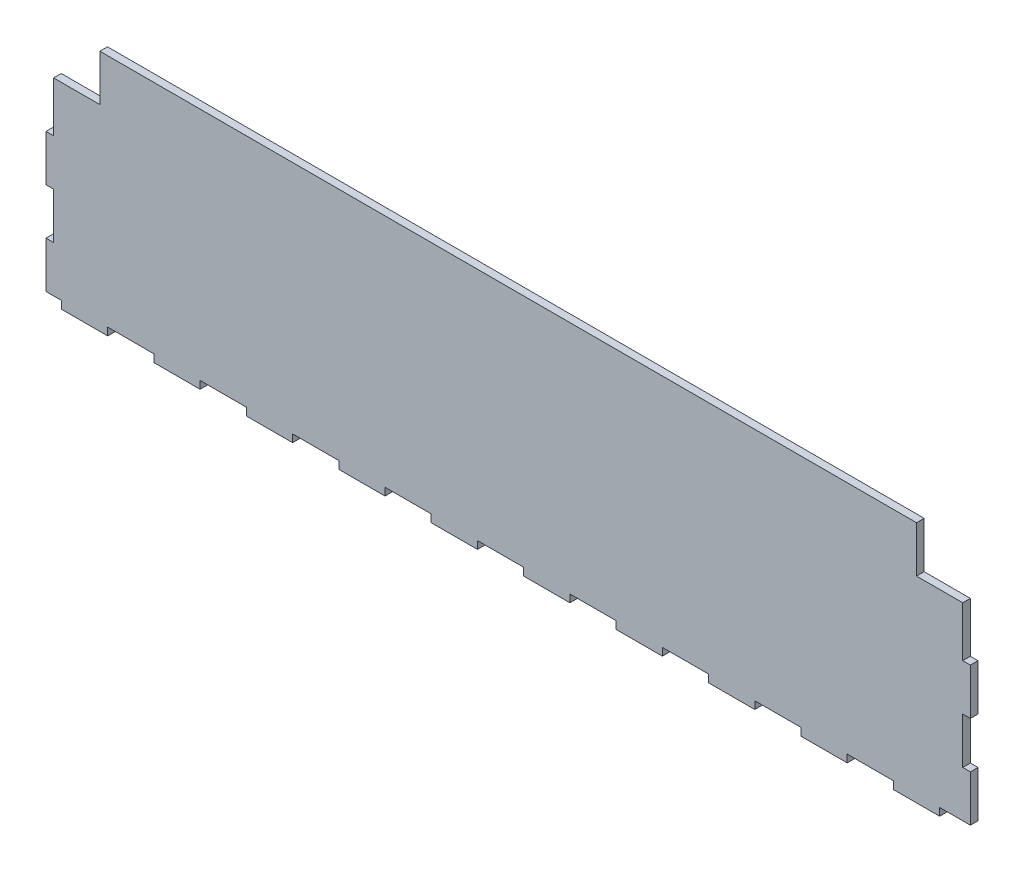
from build123d import *

# Parameters (mm, degrees)
BOSS_EXTRUDE1_DEPTH = 3.3
SKETCH2_W           = 20
SKETCH2_H           = 3.3
BOSS_EXTRUDE2_DEPTH = 3.3
SKETCH3_W           = 3.3
SKETCH3_H           = 20
BOSS_EXTRUDE3_DEPTH = 3.3


with BuildPart() as part:
    # Sketch1 → Boss-Extrude1 (new body)
    with BuildSketch(Plane.XY):
        Polygon((0, -121.512388333), (393.4, -121.512388333), (393.4, -39.804293747), (373.4, -39.804293747), (373.4, -19.804293747), (20, -19.804293747), (20, -39.804293747), (0, -39.804293747), align=None)
    extrude(amount=-BOSS_EXTRUDE1_DEPTH)

    # Sketch2 → Boss-Extrude2 (add)
    with BuildSketch(Plane.XY):
        with Locations((333.4, -123.162388333)):
            Rectangle(SKETCH2_W, SKETCH2_H)
        with Locations((373.4, -123.162388333)):
            Rectangle(SKETCH2_W, SKETCH2_H)
        with Locations((293.4, -123.162388333)):
            Rectangle(SKETCH2_W, SKETCH2_H)
        with Locations((253.4, -123.162388333)):
            Rectangle(SKETCH2_W, SKETCH2_H)
        with Locations((213.4, -123.162388333)):
            Rectangle(SKETCH2_W, SKETCH2_H)
        with Locations((173.4, -123.162388333)):
            Rectangle(SKETCH2_W, SKETCH2_H)
        with Locations((133.4, -123.162388333)):
            Rectangle(SKETCH2_W, SKETCH2_H)
        with Locations((93.4, -123.162388333)):
            Rectangle(SKETCH2_W, SKETCH2_H)
        with Locations((53.4, -123.162388333)):
            Rectangle(SKETCH2_W, SKETCH2_H)
        with Locations((13.4, -123.162388333)):
            Rectangle(SKETCH2_W, SKETCH2_H)
    extrude(amount=-BOSS_EXTRUDE2_DEPTH)

    # Sketch3 → Boss-Extrude3 (add)
    with BuildSketch(Plane.XY):
        with Locations((395.05, -111.512388365)):
            Rectangle(SKETCH3_W, SKETCH3_H)
        with Locations((395.05, -71.512388365)):
            Rectangle(SKETCH3_W, SKETCH3_H)
        with Locations((-1.65, -111.512388365)):
            Rectangle(SKETCH3_W, SKETCH3_H)
        with Locations((-1.65, -71.512388365)):
            Rectangle(SKETCH3_W, SKETCH3_H)
    extrude(amount=-BOSS_EXTRUDE3_DEPTH)


solid = part.part
